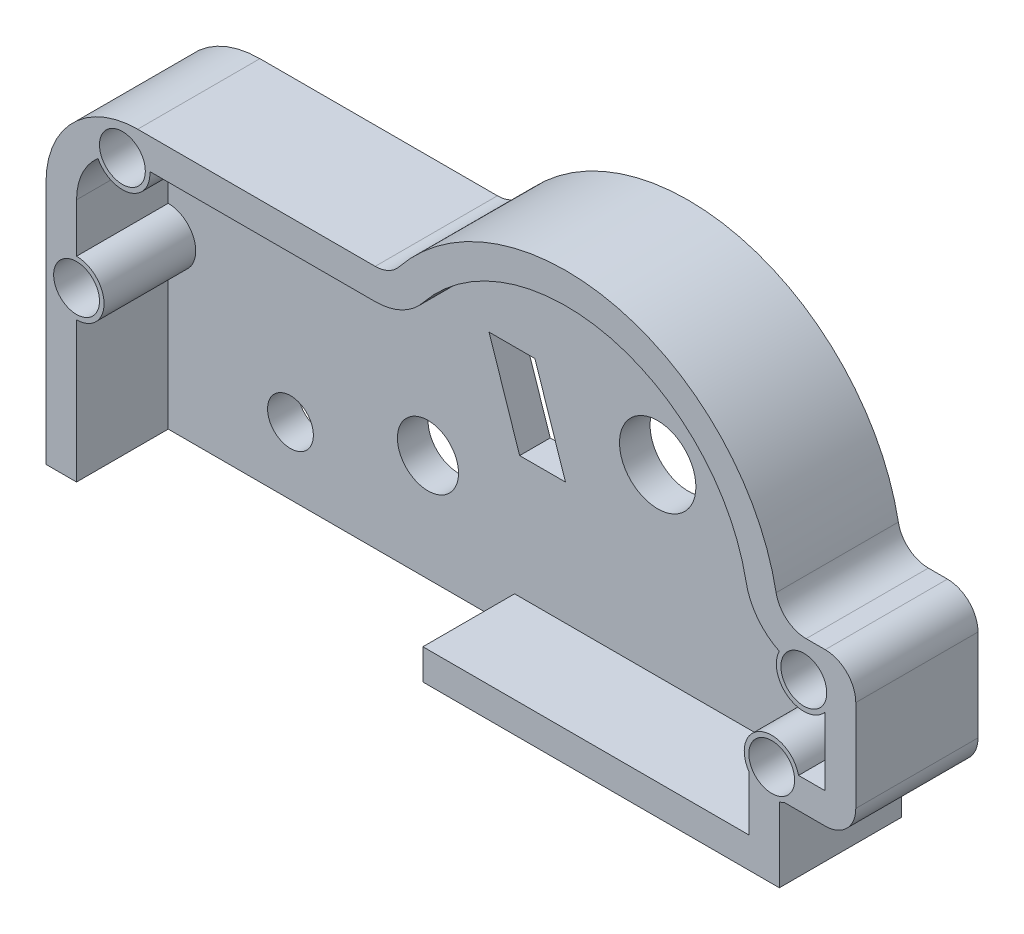
from build123d import *

# Parameters (mm, degrees)
BOSS_EXTRUDE1_DEPTH = 4
SHELL1_START        = 1
SHELL1_DEPTH        = 3
SKETCH2_R           = 1.25
SKETCH2_R_2         = 0.75
SKETCH2_R_3         = 1
CUT_EXTRUDE1_DEPTH  = 10
SKETCH3_W           = 10.665868521
SKETCH3_H           = 3
BOSS_EXTRUDE2_DEPTH = 1
SKETCH4_R           = 0.9
BOSS_EXTRUDE3_DEPTH = 3
SKETCH5_R           = 0.75
CUT_EXTRUDE2_DEPTH  = 3


# Read off the part's stored shape, not the designer's step: Shell1
with BuildPart() as part:
    # Sketch1 → Boss-Extrude1 (new body)
    with BuildSketch(Plane.XY):
        with BuildLine():
            Line((-17.017879978, -7), (6.982120022, -7))
            Line((6.982120022, -7), (6.982120022, -5.5))
            Line((6.982120022, -5.5), (6.982120022, -4.5))
            Line((6.982120022, -4.5), (7.982120022, -4.5))
            Line((7.982120022, -4.5), (8.482120022, -4.5))
            ThreePointArc((8.482120022, -4.5), (9.189226803, -4.207106781), (9.482120022, -3.5))
            Line((9.482120022, -3.5), (9.482120022, -0.5))
            ThreePointArc((9.482120022, -0.5), (9.189226803, 0.207106781), (8.482120022, 0.5))
            Line((8.482120022, 0.5), (7.858116823, 0.5))
            ThreePointArc((7.858116823, 0.5), (7.220739384, 0.72944825), (6.87585222, 1.3125))
            ThreePointArc((6.87585222, 1.3125), (1.68605895, 6.793909421), (-5.464373249, 4.375))
            ThreePointArc((-5.464373249, 4.375), (-5.811985297, 4.098612181), (-6.244997998, 4))
            Line((-6.244997998, 4), (-14.017879978, 4))
            ThreePointArc((-14.017879978, 4), (-16.139200322, 3.121320344), (-17.017879978, 1))
            Line((-17.017879978, 1), (-17.017879978, -7))
        make_face()
    extrude(amount=BOSS_EXTRUDE1_DEPTH)

    # Shell1 outline → Shell1 (cut)
    with BuildSketch(Plane.XY.offset(SHELL1_START)):
        with BuildLine():
            Line((-16.017879978, 1), (-16.017879978, -7))
            Line((-16.017879978, -7), (5.982120022, -7))
            Line((5.982120022, -7), (5.982120022, -3.5))
            Line((5.982120022, -3.5), (8.482120022, -3.5))
            Line((8.482120022, -3.5), (8.482120022, -0.5))
            Line((8.482120022, -0.5), (7.858116823, -0.5))
            ThreePointArc((7.858116823, -0.5), (6.583361944, -0.041103501), (5.893587617, 1.125))
            ThreePointArc((5.893587617, 1.125), (1.445193386, 5.823350932), (-4.683748499, 3.75))
            ThreePointArc((-4.683748499, 3.75), (-5.378972594, 3.197224362), (-6.244997998, 3))
            Line((-6.244997998, 3), (-14.017879978, 3))
            ThreePointArc((-14.017879978, 3), (-15.43209354, 2.414213562), (-16.017879978, 1))
        make_face()
    extrude(amount=SHELL1_DEPTH, mode=Mode.SUBTRACT)

    # Sketch2 → Cut-Extrude1 (cut)
    with BuildSketch(Plane.XY.offset(1)):
        Circle(SKETCH2_R)
        with Locations((-12.017879978, -4.8)):
            Circle(SKETCH2_R_2)
        with Locations((-7.517879978, -3.5)):
            Circle(SKETCH2_R_3)
        Polygon((-5.517879978, 1), (-4.017879978, 1), (-3.017879978, -2), (-4.517879978, -2), align=None)
    extrude(amount=-CUT_EXTRUDE1_DEPTH, mode=Mode.SUBTRACT)

    # Sketch3 → Boss-Extrude2 (add)
    with BuildSketch(Plane.XZ.offset(7)):
        with Locations((0.649185762, 2.5)):
            Rectangle(SKETCH3_W, SKETCH3_H)
    extrude(amount=-BOSS_EXTRUDE2_DEPTH)

    # Sketch4 → Boss-Extrude3 (add)
    with BuildSketch(Plane.XY.offset(1)):
        with Locations((-14.517879978, 2.936491673)):
            Circle(SKETCH4_R)
        with Locations((-16.017879978, -1.5)):
            Circle(SKETCH4_R)
        with Locations((7.782120022, -0.7)):
            Circle(SKETCH4_R)
        with Locations((6.732120022, -3.7)):
            Circle(SKETCH4_R)
    extrude(amount=BOSS_EXTRUDE3_DEPTH)

    # Sketch5 → Cut-Extrude2 (cut)
    with BuildSketch(Plane.XY.offset(4)):
        with Locations((-14.517879978, 2.936491673)):
            Circle(SKETCH5_R)
        with Locations((-16.017879978, -1.5)):
            Circle(SKETCH5_R)
        with Locations((6.732120022, -3.7)):
            Circle(SKETCH5_R)
        with Locations((7.782120022, -0.7)):
            Circle(SKETCH5_R)
    extrude(amount=-CUT_EXTRUDE2_DEPTH, mode=Mode.SUBTRACT)


solid = part.part
